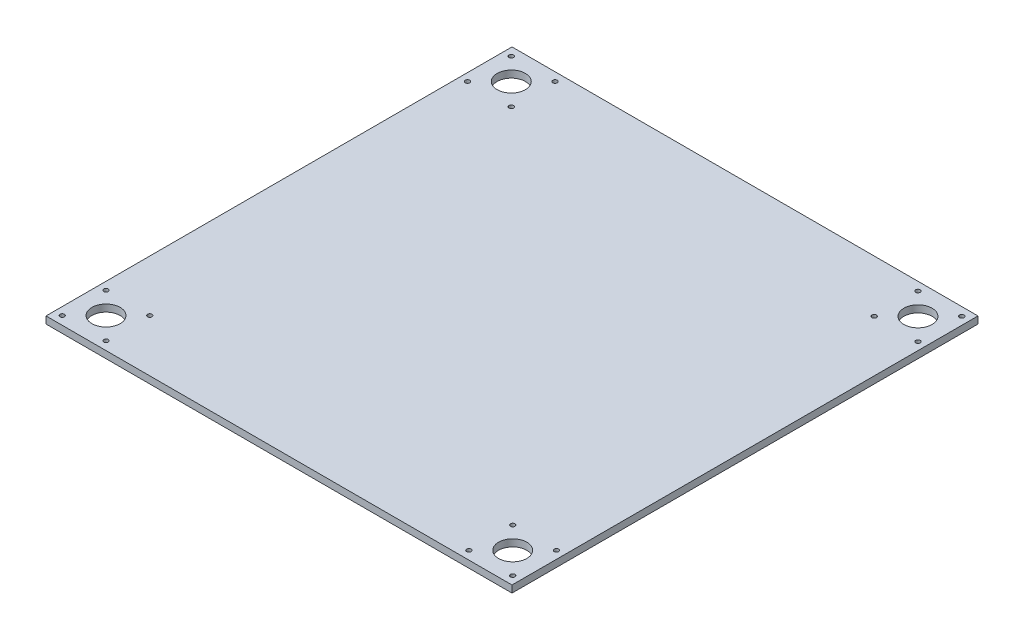
from build123d import *

# Parameters (mm, degrees)
SKETCH_1_W          = 330
SKETCH_1_H          = 330
EXTRUDE_1_DEPTH     = 5
SKETCH_2_R          = 1.6
SKETCH_2_R_2        = 1.602203763
CUT_EXTRUDE_1_DEPTH = 234.39880034
SKETCH_3_W          = 220
SKETCH_3_H          = 20
CUT_EXTRUDE_2_DEPTH = 234.39880034
SKETCH_9_W          = 239.54111937
SKETCH_9_H          = 233.56752537
EXTRUDE_2_DEPTH     = 5
SKETCH_10_R         = 10
CUT_EXTRUDE_5_DEPTH = 10


with BuildPart() as part:
    # 草图1 → 凸台-拉伸1 (new body)
    with BuildSketch(Plane(origin=(0, 0, 0), x_dir=(1, 0, 0), z_dir=(0, 1, 0))):
        Rectangle(SKETCH_1_W, SKETCH_1_H)
    extrude(amount=EXTRUDE_1_DEPTH)

    # 草图2 → 切除-拉伸1 (cut, through all)
    with BuildSketch(Plane(origin=(0, 5, 0), x_dir=(1, 0, 0), z_dir=(0, 1, 0))):
        with Locations((-159.5, 159)):
            Circle(SKETCH_2_R)
        with Locations((-128.5, 159)):
            Circle(SKETCH_2_R)
        with Locations((-159.5, 128)):
            Circle(SKETCH_2_R_2)
        with Locations((-128.5, 128)):
            Circle(SKETCH_2_R)
        with Locations((128.5, 159)):
            Circle(SKETCH_2_R)
        with Locations((159.5, 159)):
            Circle(SKETCH_2_R)
        with Locations((128.5, 128)):
            Circle(SKETCH_2_R)
        with Locations((159.5, 128)):
            Circle(SKETCH_2_R)
        with Locations((128.5, -128)):
            Circle(SKETCH_2_R)
        with Locations((159.5, -128)):
            Circle(SKETCH_2_R)
        with Locations((159.5, -159)):
            Circle(SKETCH_2_R)
        with Locations((128.5, -159)):
            Circle(SKETCH_2_R)
        with Locations((-128.5, -159)):
            Circle(SKETCH_2_R)
        with Locations((-159.5, -159)):
            Circle(SKETCH_2_R)
        with Locations((-159.5, -128)):
            Circle(SKETCH_2_R)
        with Locations((-128.5, -128)):
            Circle(SKETCH_2_R)
    extrude(amount=-CUT_EXTRUDE_1_DEPTH, mode=Mode.SUBTRACT)

    # 草图3 → 切除-拉伸2 (cut, through all)
    with BuildSketch(Plane(origin=(0, 5, 0), x_dir=(1, 0, 0), z_dir=(0, 1, 0))):
        with Locations((0, 50)):
            Rectangle(SKETCH_3_W, SKETCH_3_H)
        with Locations((0, 100)):
            Rectangle(SKETCH_3_W, SKETCH_3_H)
        Rectangle(SKETCH_3_W, SKETCH_3_H)
        with Locations((0, -50)):
            Rectangle(SKETCH_3_W, SKETCH_3_H)
        with Locations((0, -100)):
            Rectangle(SKETCH_3_W, SKETCH_3_H)
    extrude(amount=-CUT_EXTRUDE_2_DEPTH, mode=Mode.SUBTRACT)

    # 草图9 → 凸台-拉伸2 (add)
    with BuildSketch(Plane(origin=(0, 5, 0), x_dir=(1, 0, 0), z_dir=(0, 1, 0))):
        with Locations((2.0907579, 0.2986797)):
            Rectangle(SKETCH_9_W, SKETCH_9_H)
    extrude(amount=-EXTRUDE_2_DEPTH)

    # 草图10 → 切除-拉伸5 (cut)
    with BuildSketch(Plane(origin=(0, 5, 0), x_dir=(1, 0, 0), z_dir=(0, 1, 0))):
        with Locations((-144, 143.5)):
            Circle(SKETCH_10_R)
        with Locations((144, 143.5)):
            Circle(SKETCH_10_R)
        with Locations((144, -143.5)):
            Circle(SKETCH_10_R)
        with Locations((-144, -143.5)):
            Circle(SKETCH_10_R)
    extrude(amount=-CUT_EXTRUDE_5_DEPTH, mode=Mode.SUBTRACT)


solid = part.part
